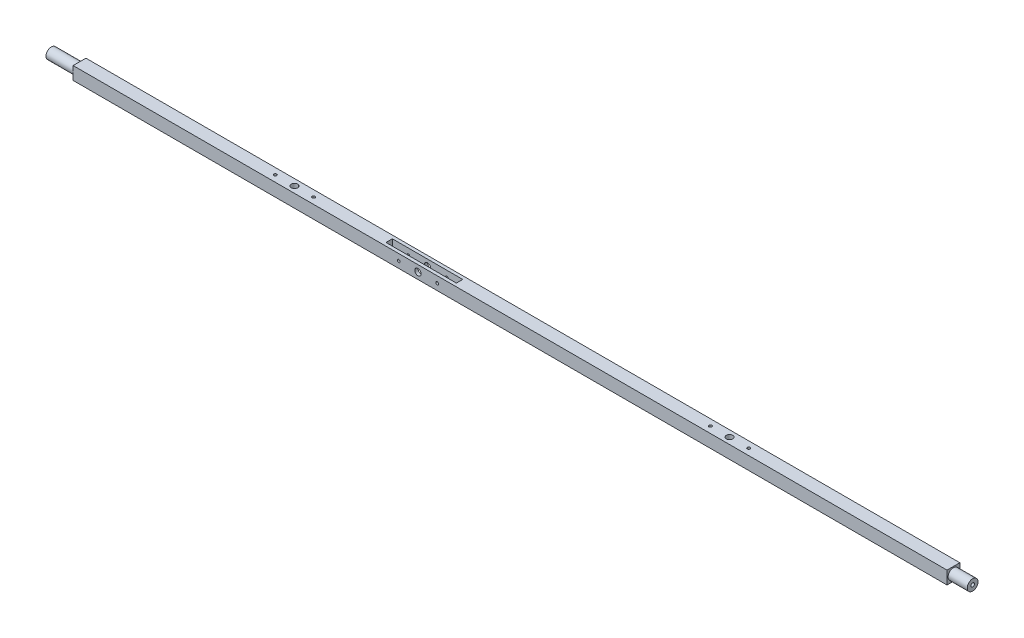
from build123d import *

# Parameters (mm, degrees)
SKETCH1_W                       = 12.7
SKETCH1_H                       = 12.82133758
LENGTH_DEPTH                    = 457.2
SKETCH2_W                       = 12.7
SKETCH2_H                       = 12.82133758
SKETCH2_R                       = 5.334
ROUND_CUT_1_DEPTH               = 19.05
ROUND_START                     = -27.94
SKETCH3_W                       = 12.7
SKETCH3_H                       = 12.82133758
SKETCH3_R                       = 5.334
ROUND_CUT_2_DEPTH               = 27.94
SKETCH14_R                      = 1.7526
CUT_EXTRUDE6_DEPTH              = 12.7
CUT_EXTRUDE7_START              = -19.05
SKETCH15_R                      = 1.7526
CUT_EXTRUDE7_DEPTH              = 19.05
BOTTOM_WASHER_R                 = 1.4224
BOTTOM_WASHER_BOLTS_DEPTH       = 10.922
BOTTOM_WASHER_CENTER_BOLT_REACH = 459.424
SKETCH18_R                      = 3.175
TOP_WASHER_CENTER_BOLT_REACH    = 459.424
SKETCH17_R                      = 3.175
SKETCH16_R                      = 1.4224
TOP_WASHER_DEPTH                = 10.922
SKETCH19_W                      = 69.85
SKETCH19_H                      = 6.35
CUT_EXTRUDE8_DEPTH              = 458.423817917
SKETCH20_R                      = 1.397
SKETCH20_R_2                    = 3.175
CUT_EXTRUDE9_DEPTH              = 458.42127921


with BuildPart() as part:
    # Sketch1 → Length (new, symmetric)
    with BuildSketch(Plane(origin=(0, 0, 0), x_dir=(0, 0, -1), z_dir=(1, 0, 0))):
        Rectangle(SKETCH1_W, SKETCH1_H)
    extrude(amount=LENGTH_DEPTH, both=True)

    # Sketch2 → Round Cut 1 (cut)
    with BuildSketch(Plane(origin=(457.2, 0, 0), x_dir=(0, 0, -1), z_dir=(1, 0, 0))):
        Rectangle(SKETCH2_W, SKETCH2_H)
        Circle(SKETCH2_R, mode=Mode.SUBTRACT)
    extrude(amount=-ROUND_CUT_1_DEPTH, mode=Mode.SUBTRACT)

    # Sketch3 → Round Cut 2 (cut)
    with BuildSketch(Plane.ZY.offset(457.2).offset(ROUND_START)):
        Rectangle(SKETCH3_W, SKETCH3_H)
        Circle(SKETCH3_R, mode=Mode.SUBTRACT)
    extrude(amount=ROUND_CUT_2_DEPTH, mode=Mode.SUBTRACT)

    # Sketch14 → Cut-Extrude6 (cut)
    with BuildSketch(Plane(origin=(457.2, 0, 0), x_dir=(0, 0, -1), z_dir=(1, 0, 0))):
        Circle(SKETCH14_R)
    extrude(amount=-CUT_EXTRUDE6_DEPTH, mode=Mode.SUBTRACT)

    # Sketch15 → Cut-Extrude7 (cut)
    with BuildSketch(Plane.ZY.offset(457.2).offset(CUT_EXTRUDE7_START)):
        Circle(SKETCH15_R)
    extrude(amount=CUT_EXTRUDE7_DEPTH, mode=Mode.SUBTRACT)

    # Bottom Washer → Bottom washer bolts (cut)
    with BuildSketch(Plane(origin=(0, 6.41066879, 0), x_dir=(1, 0, 0), z_dir=(0, 1, 0))):
        with Locations((-196.85, 0)):
            Circle(BOTTOM_WASHER_R)
        with Locations((-234.95, 0)):
            Circle(BOTTOM_WASHER_R)
    extrude(amount=-BOTTOM_WASHER_BOLTS_DEPTH, mode=Mode.SUBTRACT)

    # Sketch18 → Bottom Washer Center Bolt (cut, up to next)
    with BuildSketch(Plane(origin=(0, 6.41066879, 0), x_dir=(1, 0, 0), z_dir=(0, 1, 0)), mode=Mode.PRIVATE) as bottom_washer_center_bolt_sk1:
        with Locations((-215.9, 0)):
            Circle(SKETCH18_R)
    bottom_washer_center_bolt_tool1 = extrude(bottom_washer_center_bolt_sk1.sketch, amount=-BOTTOM_WASHER_CENTER_BOLT_REACH, mode=Mode.PRIVATE) & part.part
    add(bottom_washer_center_bolt_tool1.solids().sort_by_distance((-215.9, 6.410669, 0))[0], mode=Mode.SUBTRACT)

    # Sketch17 → Top Washer Center Bolt (cut, up to next)
    with BuildSketch(Plane(origin=(0, 6.41066879, 0), x_dir=(1, 0, 0), z_dir=(0, 1, 0)), mode=Mode.PRIVATE) as top_washer_center_bolt_sk1:
        with Locations((215.9, 0)):
            Circle(SKETCH17_R)
    top_washer_center_bolt_tool1 = extrude(top_washer_center_bolt_sk1.sketch, amount=-TOP_WASHER_CENTER_BOLT_REACH, mode=Mode.PRIVATE) & part.part
    add(top_washer_center_bolt_tool1.solids().sort_by_distance((215.9, 6.410669, 0))[0], mode=Mode.SUBTRACT)

    # Sketch16 → Top Washer (cut)
    with BuildSketch(Plane(origin=(0, 6.41066879, 0), x_dir=(1, 0, 0), z_dir=(0, 1, 0))):
        with Locations((234.95, 0)):
            Circle(SKETCH16_R)
        with Locations((196.85, 0)):
            Circle(SKETCH16_R)
    extrude(amount=-TOP_WASHER_DEPTH, mode=Mode.SUBTRACT)

    # Sketch19 → Cut-Extrude8 (cut, through all)
    with BuildSketch(Plane(origin=(0, -6.41066879, 0), x_dir=(-1, 0, 0), z_dir=(0, -1, 0))):
        with Locations((86.985602, 0)):
            Rectangle(SKETCH19_W, SKETCH19_H)
    extrude(amount=-CUT_EXTRUDE8_DEPTH, mode=Mode.SUBTRACT)

    # Sketch20 → Cut-Extrude9 (cut, through all)
    with BuildSketch(Plane.XY.offset(6.35)):
        with Locations((-106.035602, 0)):
            Circle(SKETCH20_R)
        with Locations((-86.985602, 0)):
            Circle(SKETCH20_R_2)
        with Locations((-67.935602, 0)):
            Circle(SKETCH20_R)
    extrude(amount=-CUT_EXTRUDE9_DEPTH, mode=Mode.SUBTRACT)


solid = part.part
